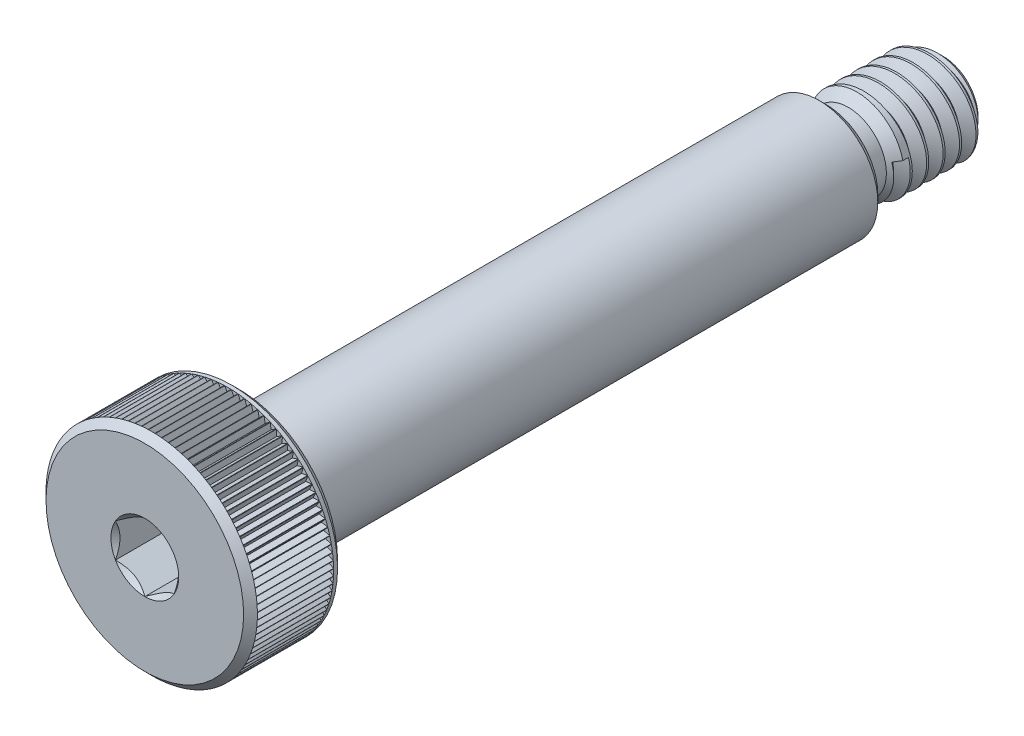
from build123d import *

# Parameters (mm, degrees)
CUT_EXTRUDE1_START = 17
CUT_EXTRUDE1_DEPTH = 2
CHAMFER1_SIZE      = 0.2925
CUT_SWEEP1_PITCH   = 0.7
CUT_EXTRUDE3_START = 16.7075
CUT_EXTRUDE3_DEPTH = 3.24425
CIRPATTERN1_COUNT  = 99


with BuildPart() as part:
    # Sketch3 → Revolve1 (revolve)
    with BuildSketch(Plane(origin=(0, 0, 0), x_dir=(0, 0, -1), z_dir=(1, 0, 0)), mode=Mode.PRIVATE) as revolve1_sk:
        with BuildLine():
            Line((-17, 0), (-17, 4.2075))
            Line((-17, 4.2075), (-16.7075, 4.5))
            Line((-16.7075, 4.5), (-13.2925, 4.5))
            Line((-13.2925, 4.5), (-13, 4.2075))
            Line((-13, 4.2075), (-13, 2.297))
            Line((-13, 2.297), (-12.492, 2.297))
            Line((-12.492, 2.297), (-12.289, 2.5))
            Line((-12.289, 2.5), (12, 2.5))
            Line((12, 2.5), (12, 1.8125))
            ThreePointArc((12, 1.8125), (12.054917479, 1.679917479), (12.1875, 1.625))
            Line((12.1875, 1.625), (12.95, 1.625))
            Line((12.95, 1.625), (13.325, 2))
            Line((13.325, 2), (16.475, 2))
            Line((16.475, 2), (17, 1.475))
            Line((17, 1.475), (17, 0))
            Line((17, 0), (-17, 0))
        make_face()
    revolve(revolve1_sk.sketch.rotate(Axis((0, 0, 17), (0, 0, -1)), 90), axis=Axis((0, 0, 17), (0, 0, -1)))

    # Sketch4 → Cut-Extrude1 (cut)
    with BuildSketch(Plane.XY.offset(CUT_EXTRUDE1_START)):
        Polygon((0, 1.443375673), (-1.25, 0.721687836), (-1.25, -0.721687836), (0, -1.443375673), (1.25, -0.721687836), (1.25, 0.721687836), align=None)
    extrude(amount=-CUT_EXTRUDE1_DEPTH, mode=Mode.SUBTRACT)

    # Cut-Extrude2 cone 1 section (through the dimple's axis) → Cut-Extrude2 (revolve, cut)
    with BuildSketch(Plane(origin=(0, 0, 17), x_dir=(0, -1, 0), z_dir=(1, 0, 0))):
        Polygon((0, 0), (1.443375673, 0), (0, 1.443375673), align=None)
    revolve(axis=Axis((0, 0, 17), (0, 0, -1)), mode=Mode.SUBTRACT)

    # Chamfer1
    chamfer1_edges = [part.edges().sort_by_distance(p)[0] for p in [
        (-2.5, 0, -12),
    ]]
    chamfer(chamfer1_edges, length=CHAMFER1_SIZE)

    # Cut-Sweep1: the profile of Sketch7 screwed along a right-hand helix of 5.785714 turns, 6 arcs to a turn; built about Z, then put on its axis
    cut_sweep1_z = Axis((0, 0, 0), (0, 0, 1))
    cut_sweep1_corners = [(2.037888611, 0, 0.021875), (1.545336663, 0, -0.2625), (1.545336663, 0, -0.35), (2.037888611, 0, -0.634375)]
    with BuildLine(mode=Mode.PRIVATE) as cut_sweep1_profile:
        Line(cut_sweep1_corners[0], cut_sweep1_corners[1])
        Line(cut_sweep1_corners[1], cut_sweep1_corners[2])
        Line(cut_sweep1_corners[2], cut_sweep1_corners[3])
        Line(cut_sweep1_corners[3], cut_sweep1_corners[0])
    cut_sweep1_cap = Face(cut_sweep1_profile.wire())
    cut_sweep1_turn_angles = [0, 30, 60, 90, 120, 150, 180, 210, 240, 270, 300, 330, 360]
    cut_sweep1_turn_weights = [1, 0.8660254037844387, 1, 0.8660254037844387, 1, 0.8660254037844387, 1, 0.8660254037844387, 1, 0.8660254037844387, 1, 0.8660254037844387, 1]
    cut_sweep1_turn_rails = [Edge.make_bspline([Vector(p[0], p[1], 0).rotate(cut_sweep1_z, cut_sweep1_turn_angles[k]) / cut_sweep1_turn_weights[k] + Vector(0, 0, p[2] + CUT_SWEEP1_PITCH * cut_sweep1_turn_angles[k] / 360) for k in range(13)], [0, 0, 0, 1, 1, 2, 2, 3, 3, 4, 4, 5, 5, 6, 6, 6], 2, cut_sweep1_turn_weights) for p in cut_sweep1_corners]
    cut_sweep1_turn_sides = [Face.make_surface_from_curves(cut_sweep1_turn_rails[p[0]], cut_sweep1_turn_rails[p[1]]) for p in [(0, 1), (1, 2), (2, 3), (3, 0)]]
    cut_sweep1_last_angles = [1800, 1830, 1860, 1890, 1920, 1950, 1980, 2010, 2040, 2061.428571429, 2082.857142857]
    cut_sweep1_last_weights = [1, 0.8660254037844387, 1, 0.8660254037844387, 1, 0.8660254037844387, 1, 0.8660254037844387, 1, 0.9308737486441961, 1]
    cut_sweep1_last_rails = [Edge.make_bspline([Vector(p[0], p[1], 0).rotate(cut_sweep1_z, cut_sweep1_last_angles[k]) / cut_sweep1_last_weights[k] + Vector(0, 0, p[2] + CUT_SWEEP1_PITCH * cut_sweep1_last_angles[k] / 360) for k in range(11)], [0, 0, 0, 1, 1, 2, 2, 3, 3, 4, 4, 5, 5, 5], 2, cut_sweep1_last_weights) for p in cut_sweep1_corners]
    cut_sweep1_last_sides = [Face.make_surface_from_curves(cut_sweep1_last_rails[p[0]], cut_sweep1_last_rails[p[1]]) for p in [(0, 1), (1, 2), (2, 3), (3, 0)]]
    cut_sweep1 = Plane(origin=(0, 0, -17), x_dir=(0, 1, 0), z_dir=(0, 0, 1)) * Solid(Shell([*[p.moved(Location((0, 0, CUT_SWEEP1_PITCH * i))) for i in range(5) for p in cut_sweep1_turn_sides], *cut_sweep1_last_sides, cut_sweep1_cap, cut_sweep1_cap.rotate(cut_sweep1_z, 2082.857142857).moved(Location((0, 0, CUT_SWEEP1_PITCH * 2082.857142857 / 360)))]))
    add(cut_sweep1, mode=Mode.SUBTRACT)

    # Sketch8 → Cut-Extrude3 (cut)
    with BuildSketch(Plane.XY.offset(CUT_EXTRUDE3_START)):
        Polygon((-0.135099963, 4.5), (0.135099963, 4.5), (0, 4.266), align=None)
    cut_extrude3 = extrude(amount=-CUT_EXTRUDE3_DEPTH, mode=Mode.SUBTRACT)

    # CirPattern1: Cut-Extrude3 ×99 about axis
    cirpattern1_axis = Axis((0, 0, 0), (0, 0, 1))
    for i in range(1, CIRPATTERN1_COUNT):
        add(cut_extrude3.rotate(cirpattern1_axis, i * 360 / CIRPATTERN1_COUNT), mode=Mode.SUBTRACT)


solid = part.part
